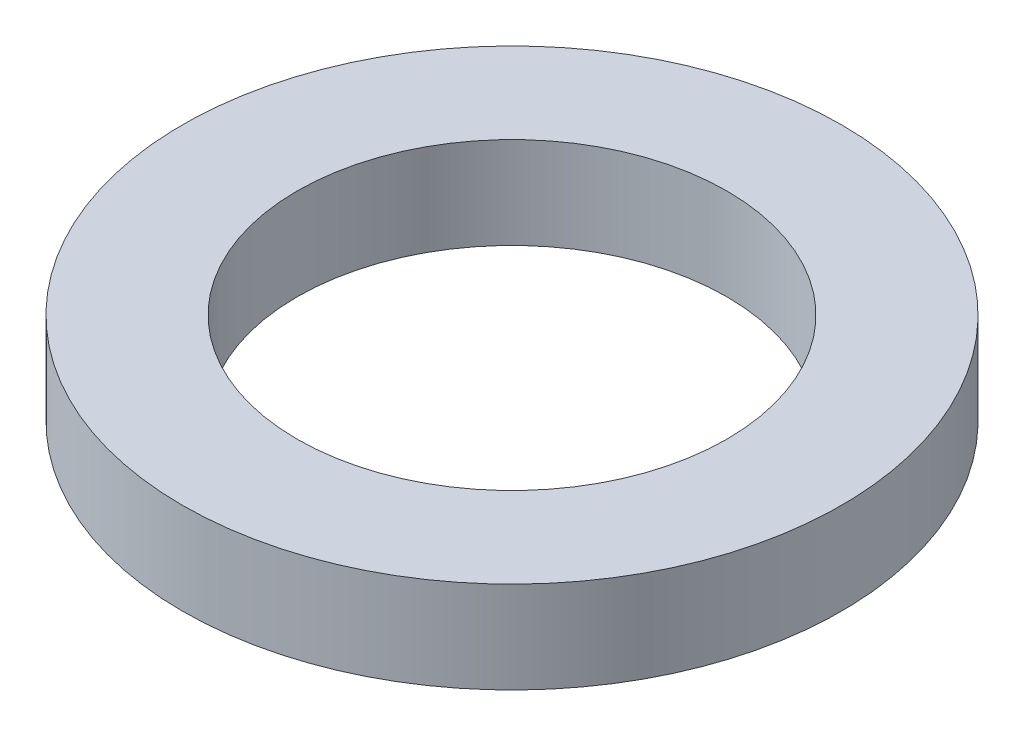
from build123d import *

# Parameters (mm, degrees)
SKETCH1_R           = 57.5
BOSS_EXTRUDE1_DEPTH = 16
SKETCH2_R           = 37.5
CUT_EXTRUDE1_DEPTH  = 83.876414015


with BuildPart() as part:
    # Sketch1 → Boss-Extrude1 (new body)
    with BuildSketch(Plane(origin=(0, 0, 0), x_dir=(1, 0, 0), z_dir=(0, 1, 0))):
        Circle(SKETCH1_R)
    extrude(amount=BOSS_EXTRUDE1_DEPTH)

    # Sketch2 → Cut-Extrude1 (cut, through all)
    with BuildSketch(Plane(origin=(0, 0, 0), x_dir=(1, 0, 0), z_dir=(0, 1, 0))):
        Circle(SKETCH2_R)
    extrude(amount=CUT_EXTRUDE1_DEPTH, mode=Mode.SUBTRACT)


solid = part.part
